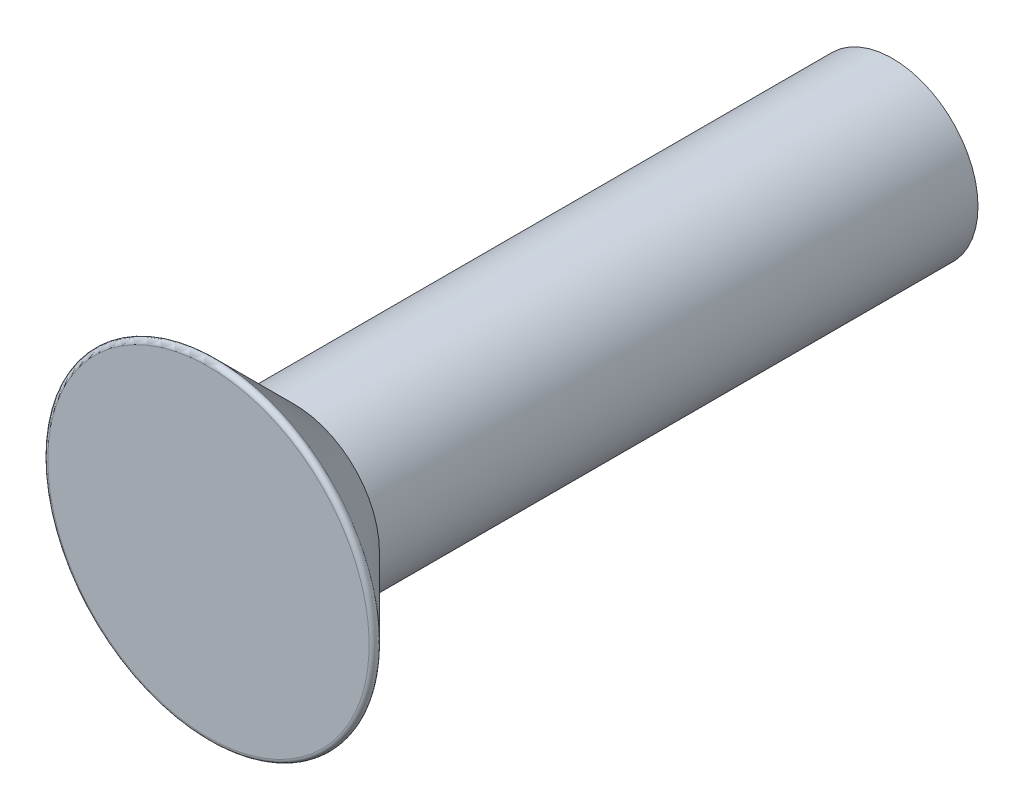
from build123d import *

# Parameters (mm, degrees)
FILLET_2_R = 0.15875


with BuildPart() as part:
    # BaseBodySke → BaseBody (revolve)
    with BuildSketch(Plane(origin=(0, 0, 0), x_dir=(1, 0, 0), z_dir=(0, 1, 0))):
        Polygon((0, 0), (-6.35, 0), (-3.175, 3.175), (-3.175, 25.4), (0, 25.4), align=None)
    revolve(axis=Axis((0, 0, 0), (0, 0, -1)))

    # Fillet 2
    fillet_2_edges = [part.edges().sort_by_distance(p)[0] for p in [
        (6.35, 0, 0),
    ]]
    fillet(fillet_2_edges, radius=FILLET_2_R)


solid = part.part
